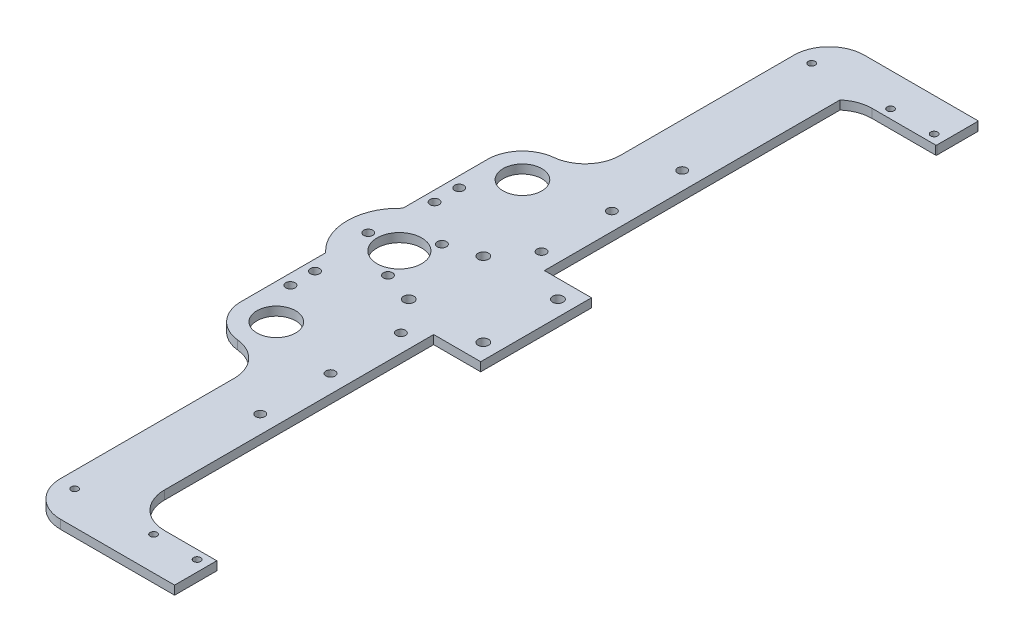
from build123d import *

# Parameters (mm, degrees)
SKETCH1_R           = 6.985
SKETCH1_R_2         = 1.6499967
SKETCH1_R_3         = 8.0645
BOSS_EXTRUDE1_DEPTH = 3.175
FILLET2_R           = 0.254
SKETCH4_R           = 1.25
CUT_EXTRUDE1_DEPTH  = 199.349545248
SKETCH5_R           = 1.89865
CUT_EXTRUDE2_DEPTH  = 199.349545248


with BuildPart() as part:
    # Sketch1 → Boss-Extrude1 (new body)
    with BuildSketch(Plane(origin=(0, 0, 0), x_dir=(1, 0, 0), z_dir=(0, 1, 0))):
        with BuildLine():
            ThreePointArc((-67.971311517, -24.866245744), (-74.128017531, -38.797272158), (-67.971311517, -52.728298572))
            Line((-67.971311517, -52.728298572), (-67.971311517, -82.586411585))
            ThreePointArc((-67.971311517, -82.586411585), (-64.941959488, -91.499608698), (-56.608448003, -95.878494725))
            ThreePointArc((-56.608448003, -95.878494725), (-48.492989851, -100.008926653), (-45.228378476, -108.509717293))
            Line((-45.228378476, -108.509717293), (-45.228378476, -171.249717293))
            ThreePointArc((-45.228378476, -171.249717293), (-41.508634597, -180.229973414), (-32.528378476, -183.949717293))
            Line((-32.528378476, -183.949717293), (7.398418219, -183.949717293))
            Line((7.398418219, -183.949717293), (8.682280525, -183.949717293))
            Line((8.682280525, -183.949717293), (8.682280525, -168.709717293))
            Line((8.682280525, -168.709717293), (-10.203517531, -168.709717293))
            ThreePointArc((-10.203517531, -168.709717293), (-19.183773652, -164.989973414), (-22.903517531, -156.009717293))
            Line((-22.903517531, -156.009717293), (-22.903517531, -64.197272158))
            Line((-22.903517531, -64.197272158), (-22.903517531, -58.797272158))
            Line((-22.903517531, -58.797272158), (-5.903517531, -58.797272158))
            Line((-5.903517531, -58.797272158), (-5.903517531, -38.797272158))
            Line((-5.903517531, -38.797272158), (-5.903517531, -18.797272158))
            Line((-5.903517531, -18.797272158), (-22.903517531, -18.797272158))
            Line((-22.903517531, -18.797272158), (-22.903517531, 87.951188553))
            ThreePointArc((-22.903517531, 87.951188553), (-18.998096245, 90.297878852), (-14.51576414, 91.115172977))
            Line((-14.51576414, 91.115172977), (8.682280525, 91.115172977))
            Line((8.682280525, 91.115172977), (8.682280525, 106.355172977))
            Line((8.682280525, 106.355172977), (-7.110618503, 106.355172977))
            Line((-7.110618503, 106.355172977), (-22.903517531, 106.355172977))
            Line((-22.903517531, 106.355172977), (-32.528378476, 106.355172977))
            ThreePointArc((-32.528378476, 106.355172977), (-41.508634597, 102.635429098), (-45.228378476, 93.655172977))
            Line((-45.228378476, 93.655172977), (-45.228378476, 30.915172977))
            ThreePointArc((-45.228378476, 30.915172977), (-48.492989851, 22.414382337), (-56.608448003, 18.28395041))
            ThreePointArc((-56.608448003, 18.28395041), (-64.941959488, 13.905064383), (-67.971311517, 4.991867269))
            Line((-67.971311517, 4.991867269), (-67.971311517, -24.866245744))
        make_face()
        with Locations((-55.288517531, -83.247272158)):
            Circle(SKETCH1_R, mode=Mode.SUBTRACT)
        with Locations((-64.161311517, -69.277272158)):
            Circle(SKETCH1_R_2, mode=Mode.SUBTRACT)
        with Locations((-64.161311517, -60.387272158)):
            Circle(SKETCH1_R_2, mode=Mode.SUBTRACT)
        with Locations((-66.528017531, -38.797272158)):
            Circle(SKETCH1_R_2, mode=Mode.SUBTRACT)
        with Locations((-55.288517531, -38.797272158)):
            Circle(SKETCH1_R_3, mode=Mode.SUBTRACT)
        with Locations((-49.668767531, -48.530964684)):
            Circle(SKETCH1_R_2, mode=Mode.SUBTRACT)
        with Locations((-29.342032123, -114.997272158)):
            Circle(SKETCH1_R_2, mode=Mode.SUBTRACT)
        with Locations((-29.342032123, -89.597272158)):
            Circle(SKETCH1_R_2, mode=Mode.SUBTRACT)
        with Locations((-29.342032123, -64.197272158)):
            Circle(SKETCH1_R_2, mode=Mode.SUBTRACT)
        with Locations((-64.161311517, -17.207272158)):
            Circle(SKETCH1_R_2, mode=Mode.SUBTRACT)
        with Locations((-64.161311517, -8.317272158)):
            Circle(SKETCH1_R_2, mode=Mode.SUBTRACT)
        with Locations((-55.288517531, 5.652727842)):
            Circle(SKETCH1_R, mode=Mode.SUBTRACT)
        with Locations((-49.668767531, -29.063579632)):
            Circle(SKETCH1_R_2, mode=Mode.SUBTRACT)
        with Locations((-29.342032123, -13.397272158)):
            Circle(SKETCH1_R_2, mode=Mode.SUBTRACT)
        with Locations((-29.342032123, 12.002727842)):
            Circle(SKETCH1_R_2, mode=Mode.SUBTRACT)
        with Locations((-29.342032123, 37.402727842)):
            Circle(SKETCH1_R_2, mode=Mode.SUBTRACT)
    extrude(amount=BOSS_EXTRUDE1_DEPTH)

    # Fillet2
    fillet2_edges = [part.edges().sort_by_distance(p)[0] for p in [
        (8.682280525, 1.5875, -91.115172977),
        (8.682280525, 1.5875, -106.355172977),
    ]]
    fillet(fillet2_edges, radius=FILLET2_R)

    # Sketch4 → Cut-Extrude1 (cut, through all)
    with BuildSketch(Plane(origin=(0, 3.175, 0), x_dir=(1, 0, 0), z_dir=(0, 1, 0))):
        with Locations((4.753970241, 94.290172977)):
            Circle(SKETCH4_R)
        with Locations((-10.971029759, 94.290172977)):
            Circle(SKETCH4_R)
        with Locations((-39.471029759, 94.290172977)):
            Circle(SKETCH4_R)
        with Locations((-39.471029759, -171.884717293)):
            Circle(SKETCH4_R)
        with Locations((-10.971029759, -171.884717293)):
            Circle(SKETCH4_R)
        with Locations((4.753970241, -171.884717293)):
            Circle(SKETCH4_R)
    extrude(amount=-CUT_EXTRUDE1_DEPTH, mode=Mode.SUBTRACT)

    # Sketch5 → Cut-Extrude2 (cut, through all)
    with BuildSketch(Plane(origin=(0, 3.175, 0), x_dir=(1, 0, 0), z_dir=(0, 1, 0))):
        with Locations((-11.500645577, -25.326887976)):
            Circle(SKETCH5_R)
        with Locations((-38.441413941, -25.326887976)):
            Circle(SKETCH5_R)
        with Locations((-38.441413941, -52.267656339)):
            Circle(SKETCH5_R)
        with Locations((-11.500645577, -52.267656339)):
            Circle(SKETCH5_R)
    extrude(amount=-CUT_EXTRUDE2_DEPTH, mode=Mode.SUBTRACT)


solid = part.part
